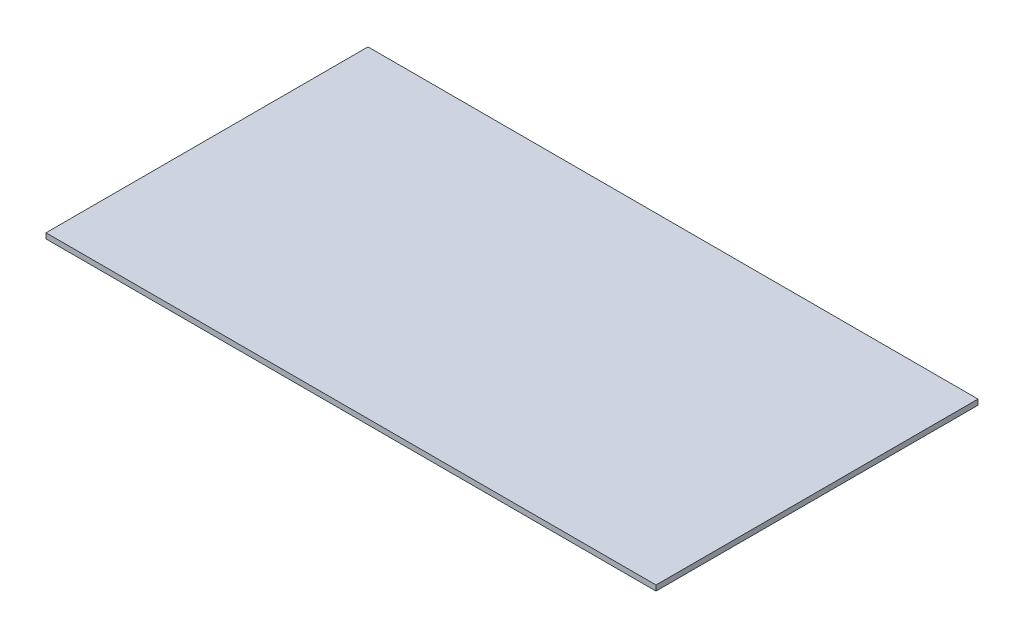
from build123d import *

# Parameters (mm, degrees)
SKETCH1_W           = 543.73
SKETCH1_H           = 4.7625
BOSS_EXTRUDE1_DEPTH = 287
CUT_EXTRUDE1_DEPTH  = 2


with BuildPart() as part:
    # Sketch1 → Boss-Extrude1 (new body)
    with BuildSketch(Plane.XY):
        with Locations((-308.730031966, 2.060431686)):
            Rectangle(SKETCH1_W, SKETCH1_H)
    extrude(amount=BOSS_EXTRUDE1_DEPTH)

    # GasketGroove → Cut-Extrude1 (cut)
    with BuildSketch(Plane.XZ.offset(0.320818314)):
        with BuildLine():
            Line((-37.865031966, 2), (-37.865031966, 285))
            ThreePointArc((-37.865031966, 285), (-38.157925185, 285.707106781), (-38.865031966, 286))
            Line((-38.865031966, 286), (-578.595031966, 286))
            ThreePointArc((-578.595031966, 286), (-579.302138747, 285.707106781), (-579.595031966, 285))
            Line((-579.595031966, 285), (-579.595031966, 2))
            ThreePointArc((-579.595031966, 2), (-579.302138747, 1.292893219), (-578.595031966, 1))
            Line((-578.595031966, 1), (-38.865031966, 1))
            ThreePointArc((-38.865031966, 1), (-38.157925185, 1.292893219), (-37.865031966, 2))
        make_face()
        with BuildLine():
            Line((-577.595031966, 283), (-577.595031966, 4))
            ThreePointArc((-577.595031966, 4), (-577.302138747, 3.292893219), (-576.595031966, 3))
            Line((-576.595031966, 3), (-40.865031966, 3))
            ThreePointArc((-40.865031966, 3), (-40.157925185, 3.292893219), (-39.865031966, 4))
            Line((-39.865031966, 4), (-39.865031966, 283))
            ThreePointArc((-39.865031966, 283), (-40.157925185, 283.707106781), (-40.865031966, 284))
            Line((-40.865031966, 284), (-576.595031966, 284))
            ThreePointArc((-576.595031966, 284), (-577.302138747, 283.707106781), (-577.595031966, 283))
        make_face(mode=Mode.SUBTRACT)
    extrude(amount=-CUT_EXTRUDE1_DEPTH, mode=Mode.SUBTRACT)


solid = part.part
